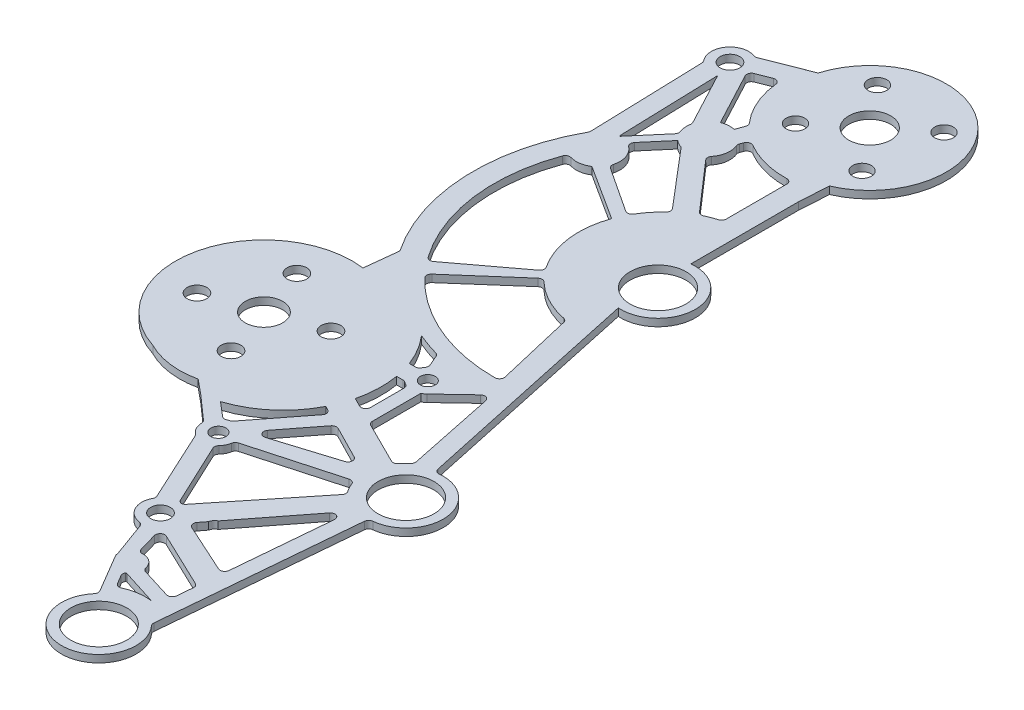
from build123d import *
from build123d.topology import SkipClean

# Parameters (mm, degrees)
SKETCH1_R            = 1.6
SKETCH1_R_2          = 2
SKETCH1_R_3          = 1.65
SKETCH1_R_4          = 6
BOSS_EXTRUDE2_DEPTH  = 1.5875
BOSS_EXTRUDE3_START  = -1.5875
BOSS_EXTRUDE3_DEPTH  = 1.5875
SKETCH4_R            = 4.4
SKETCH4_R_2          = 2.1
CUT_EXTRUDE1_DEPTH   = 1.5875
BOSS_EXTRUDE4_START  = -1.5875
BOSS_EXTRUDE4_DEPTH  = 1.5875
SKETCH7_R            = 2.1
CUT_EXTRUDE2_DEPTH   = 1.5875
CUT_EXTRUDE3_DEPTH   = 1.5875
CUT_EXTRUDE4_DEPTH   = 1.5875
SKETCH10_R           = 4.645349595
BOSS_EXTRUDE5_DEPTH  = 1.5875
CUT_EXTRUDE5_DEPTH   = 1.5875
CUT_EXTRUDE9_DEPTH   = 1.5875
SKETCH19_R           = 4
BOSS_EXTRUDE8_DEPTH  = 1.5875
SKETCH20_R           = 2.1
CUT_EXTRUDE12_DEPTH  = 1.5875
FILLET1_START        = -1
FILLET1_DEPTH        = 4
FILLET1_2_DEPTH      = 1.5875
SKETCH21_R           = 21
BOSS_EXTRUDE9_DEPTH  = 1.5875
SKETCH22_R           = 19
SKETCH22_R_2         = 16.40193841
CUT_EXTRUDE13_DEPTH  = 1.5875
FILLET2_R            = 5
SKETCH23_R           = 8
BOSS_EXTRUDE10_DEPTH = 1.5875
SKETCH24_R           = 6
CUT_EXTRUDE14_DEPTH  = 1.5875
BOSS_EXTRUDE12_DEPTH = 1.5875
CUT_EXTRUDE15_DEPTH  = 10
BOSS_EXTRUDE13_DEPTH = 1.5875
SKETCH30_R           = 16.40193841
BOSS_EXTRUDE14_DEPTH = 1.5875
SKETCH31_R           = 4
SKETCH31_R_2         = 2.1
CUT_EXTRUDE16_DEPTH  = 1.5875
SKETCH33_R           = 18.948767504
SKETCH33_R_2         = 2.1
SKETCH33_R_3         = 4
BOSS_EXTRUDE15_DEPTH = 1.5875
SKETCH34_R           = 4.5
SKETCH34_R_2         = 2
CUT_EXTRUDE18_DEPTH  = 10


with BuildPart() as part:
    # Sketch1 → Boss-Extrude2 (new body)
    with BuildSketch(Plane(origin=(0, 0, 0), x_dir=(1, 0, 0), z_dir=(0, 1, 0))):
        with BuildLine():
            Line((57.785577921, -3.804263015), (46.607089569, 48.169037391))
            ThreePointArc((46.607089569, 48.169037391), (54.607089569, 56.169037391), (46.607089569, 64.169037391))
            Line((46.607089569, 64.169037391), (46.607089569, 96.669037391))
            ThreePointArc((46.607089569, 96.669037391), (9.774896481, 73.010639225), (15.974342375, 29.675928865))
            Line((15.974342375, 29.675928865), (13.412399058, 22.705365919))
            ThreePointArc((13.412399058, 22.705365919), (-1.253243965, 6.307648563), (13.412399058, -10.090068793))
            Line((13.412399058, -10.090068793), (44.33382846, -62.316035804))
            ThreePointArc((44.33382846, -62.316035804), (50, -75.963557391), (55.66617154, -62.316035804))
            Line((55.66617154, -62.316035804), (59.462816555, -19.578912916))
            ThreePointArc((59.462816555, -19.578912916), (67.394599283, -10.759075533), (57.785577921, -3.804263015))
        make_face()
        with Locations(Location((27.233234802, -19.578912916, 0), (0, 0, 270))):
            Circle(SKETCH1_R, mode=Mode.SUBTRACT)
        with Locations(Location((44.33382846, -37.488387538, 0), (0, 0, 270))):
            Circle(SKETCH1_R, mode=Mode.SUBTRACT)
        with Locations(Location((40.089632361, 12.439739227, 0), (0, 0, 270))):
            Circle(SKETCH1_R, mode=Mode.SUBTRACT)
        with Locations(Location((12.005418324, 17.147101033, 0), (0, 0, 270))):
            Circle(SKETCH1_R_2, mode=Mode.SUBTRACT)
        with Locations(Location((26.086208505, 9.548986275, 0), (0, 0, 270))):
            Circle(SKETCH1_R_3, mode=Mode.SUBTRACT)
        with Locations(Location((4.407303566, 3.066310852, 0), (0, 0, 270))):
            Circle(SKETCH1_R_2, mode=Mode.SUBTRACT)
        with Locations(Location((18.488093747, -4.531803906, 0), (0, 0, 270))):
            Circle(SKETCH1_R_3, mode=Mode.SUBTRACT)
        with Locations(Location((46.607089569, 56.169037391, 0), (0, 0, 270))):
            Circle(SKETCH1_R_4, mode=Mode.SUBTRACT)
        with Locations(Location((59.462816555, -11.60242182, 0), (0, 0, 270))):
            Circle(SKETCH1_R_4, mode=Mode.SUBTRACT)
        with Locations(Location((50, -67.963557391, 0), (0, 0, 270))):
            Circle(SKETCH1_R_4, mode=Mode.SUBTRACT)
    extrude(amount=BOSS_EXTRUDE2_DEPTH)

    # Sketch3 → Boss-Extrude3 (add)
    with BuildSketch(Plane(origin=(0, 1.5875, 0), x_dir=(1, 0, 0), z_dir=(0, 1, 0)).offset(BOSS_EXTRUDE3_START)):
        with BuildLine():
            ThreePointArc((56.343437375, 106.672616503), (38.029280092, 122.267991205), (25.551142047, 101.702968958))
            ThreePointArc((25.551142047, 101.702968958), (27.87263843, 97.242332074), (31.478334129, 93.737252132))
            ThreePointArc((31.478334129, 93.737252132), (38.901984022, 95.929336038), (46.607089569, 96.669037391))
            Line((46.607089569, 96.669037391), (46.607089569, 92.08436081))
            ThreePointArc((46.607089569, 92.08436081), (53.685796044, 97.903157102), (56.343437375, 106.672616503))
        make_face()
        with BuildLine():
            ThreePointArc((46.607089569, 96.669037391), (38.901984022, 95.929336038), (31.478334129, 93.737252132))
            ThreePointArc((31.478334129, 93.737252132), (38.83054718, 90.968883646), (46.607089569, 92.08436081))
            Line((46.607089569, 92.08436081), (46.607089569, 96.669037391))
        make_face()
        with BuildLine():
            Line((25.551142047, 101.702968958), (23.684957519, 89.558045497))
            ThreePointArc((23.684957519, 89.558045497), (27.467237121, 91.860997946), (31.478334129, 93.737252132))
            ThreePointArc((31.478334129, 93.737252132), (27.87263843, 97.242332074), (25.551142047, 101.702968958))
        make_face()
        with BuildLine():
            Line((14.718034312, 31.202296417), (13.412399058, 22.705365919))
            Line((13.412399058, 22.705365919), (15.974342375, 29.675928865))
            ThreePointArc((15.974342375, 29.675928865), (15.33687379, 30.431446107), (14.718034312, 31.202296417))
        make_face()
    extrude(amount=BOSS_EXTRUDE3_DEPTH)

    # Sketch4 → Cut-Extrude1 (cut)
    with BuildSketch(Plane(origin=(0, 1.5875, 0), x_dir=(1, 0, 0), z_dir=(0, 1, 0))):
        with Locations(Location((40.546257627, 106.672616503, 0), (0, 0, 270))):
            Circle(SKETCH4_R)
        with Locations(Location((40.546257627, 117.14024961, 0), (0, 0, 270))):
            Circle(SKETCH4_R_2)
        with Locations(Location((30.07862452, 106.672616503, 0), (0, 0, 270))):
            Circle(SKETCH4_R_2)
        with Locations(Location((51.013890734, 106.672616503, 0), (0, 0, 270))):
            Circle(SKETCH4_R_2)
        with Locations(Location((40.546257627, 96.204983396, 0), (0, 0, 270))):
            Circle(SKETCH4_R_2)
    extrude(amount=-CUT_EXTRUDE1_DEPTH, mode=Mode.SUBTRACT)

    # Sketch5 → Boss-Extrude4 (add)
    with BuildSketch(Plane(origin=(0, 1.5875, 0), x_dir=(1, 0, 0), z_dir=(0, 1, 0)).offset(BOSS_EXTRUDE4_START)):
        with BuildLine():
            ThreePointArc((25.551142047, 101.702968958), (24.749079693, 106.66504565), (25.546385494, 111.627888844))
            Line((25.546385494, 111.627888844), (15.069905078, 107.519355049))
            ThreePointArc((15.069905078, 107.519355049), (16.746586116, 106.043341376), (17.370320575, 103.898386599))
            ThreePointArc((17.370320575, 103.898386599), (14.869777486, 100.190067711), (10.494506089, 101.118154407))
            Line((10.494506089, 101.118154407), (11.270868269, 75.957960157))
            ThreePointArc((11.270868269, 75.957960157), (16.694725669, 83.472892173), (23.684957519, 89.558045497))
            Line((23.684957519, 89.558045497), (25.551142047, 101.702968958))
        make_face()
        with BuildLine():
            ThreePointArc((17.370320575, 103.898386599), (16.746586116, 106.043341376), (15.069905078, 107.519355049))
            Line((15.069905078, 107.519355049), (10.494506089, 101.118154407))
            ThreePointArc((10.494506089, 101.118154407), (14.869777486, 100.190067711), (17.370320575, 103.898386599))
        make_face()
        with BuildLine():
            Line((10.494506089, 101.118154407), (15.069905078, 107.519355049))
            ThreePointArc((15.069905078, 107.519355049), (10.116135322, 106.224387102), (10.494506089, 101.118154407))
        make_face()
    extrude(amount=BOSS_EXTRUDE4_DEPTH)

    # Sketch7 → Cut-Extrude2 (cut)
    with BuildSketch(Plane(origin=(0, 1.5875, 0), x_dir=(1, 0, 0), z_dir=(0, 1, 0))):
        with Locations(Location((13.370320575, 103.898386599, 0), (0, 0, 270))):
            Circle(SKETCH7_R)
    extrude(amount=-CUT_EXTRUDE2_DEPTH, mode=Mode.SUBTRACT)

    # Sketch8 → Cut-Extrude3 (cut)
    with BuildSketch(Plane(origin=(0, 1.5875, 0), x_dir=(1, 0, 0), z_dir=(0, 1, 0))):
        with BuildLine():
            Line((22.270838211, 106.046731613), (17.002624642, 103.98071014))
            Line((17.002624642, 103.98071014), (25.133766385, 88.688000928))
            Line((25.133766385, 88.688000928), (27.134869461, 94.242115541))
            ThreePointArc((27.134869461, 94.242115541), (23.639138303, 99.70612507), (22.270838211, 106.046731613))
        make_face()
        with BuildLine():
            Line((23.303910604, 83.609187721), (14.527339538, 100.115793242))
            Line((14.527339538, 100.115793242), (15.199341327, 78.337690198))
            ThreePointArc((15.199341327, 78.337690198), (19.20721627, 76.294929401), (19.633932022, 71.816777227))
            Line((19.633932022, 71.816777227), (30.72905948, 64.509035556))
            ThreePointArc((30.72905948, 64.509035556), (32.607236437, 67.379368393), (34.997517814, 69.839635497))
            Line((34.997517814, 69.839635497), (23.303910604, 83.609187721))
        make_face()
        with BuildLine():
            ThreePointArc((19.292849703, 71.170332955), (16.555809564, 69.154810129), (13.177202224, 69.527279496))
            ThreePointArc((13.177202224, 69.527279496), (10.918653361, 51.442990309), (17.806438222, 34.569905881))
            Line((17.806438222, 34.569905881), (32.25869406, 45.408416813))
            ThreePointArc((32.25869406, 45.408416813), (28.762210797, 54.372454379), (30.401676947, 63.853567998))
            Line((30.401676947, 63.853567998), (19.292849703, 71.170332955))
        make_face()
    extrude(amount=-CUT_EXTRUDE3_DEPTH, mode=Mode.SUBTRACT)

    # Sketch9 → Cut-Extrude4 (cut)
    with BuildSketch(Plane(origin=(0, 1.5875, 0), x_dir=(1, 0, 0), z_dir=(0, 1, 0))):
        with BuildLine():
            ThreePointArc((42.074546437, 88.450459111), (35.884397618, 88.990711969), (30.232534907, 91.572622783))
            Line((30.232534907, 91.572622783), (29.429468095, 89.400967731))
            ThreePointArc((29.429468095, 89.400967731), (29.783097277, 88.406341356), (29.90303822, 87.357556633))
            ThreePointArc((29.90303822, 87.357556633), (29.485817932, 85.43344764), (28.309102029, 83.854964865))
            Line((28.309102029, 83.854964865), (38.418011185, 72.251364401))
            ThreePointArc((38.418011185, 72.251364401), (40.208614988, 73.043923164), (42.074546437, 73.637818103))
            Line((42.074546437, 73.637818103), (42.074546437, 88.450459111))
        make_face()
    extrude(amount=-CUT_EXTRUDE4_DEPTH, mode=Mode.SUBTRACT)

    # Sketch10 → Boss-Extrude5 (add)
    with BuildSketch(Plane(origin=(0, 1.5875, 0), x_dir=(1, 0, 0), z_dir=(0, 1, 0))):
        with BuildLine():
            Line((21.149022647, 85.190038065), (15.318075384, 78.339844161))
            Line((15.318075384, 78.339844161), (17.303228542, 77.909062399))
            Line((17.303228542, 77.909062399), (22.298101959, 83.77703717))
            ThreePointArc((22.298101959, 83.77703717), (21.653636497, 84.426672617), (21.149022647, 85.190038065))
        make_face()
        with Locations((25.257688625, 87.357556633)):
            Circle(SKETCH10_R)
    extrude(amount=-BOSS_EXTRUDE5_DEPTH)

    # Sketch11 → Cut-Extrude5 (cut)
    with BuildSketch(Plane(origin=(0, 1.5875, 0), x_dir=(1, 0, 0), z_dir=(0, 1, 0))):
        with BuildLine():
            ThreePointArc((43.678327763, 38.474694703), (38.177130614, 40.338585695), (33.560088051, 43.862812939))
            Line((33.560088051, 43.862812939), (19.964301754, 31.958257613))
            ThreePointArc((19.964301754, 31.958257613), (32.669274368, 22.976608926), (47.977761412, 20.195140484))
            Line((47.977761412, 20.195140484), (43.678327763, 38.474694703))
        make_face()
        with BuildLine():
            ThreePointArc((36.26030403, 18.303590576), (27.299157807, 21.99226451), (19.51475195, 27.763874553))
            Line((19.51475195, 27.763874553), (18.938710266, 22.389298788))
            ThreePointArc((18.938710266, 22.389298788), (25.46420767, 19.263484394), (30.024920763, 13.646302887))
            Line((30.024920763, 13.646302887), (36.804178947, 13.646302887))
            ThreePointArc((36.804178947, 13.646302887), (37.166998848, 14.365411409), (37.684600309, 14.982537063))
            Line((37.684600309, 14.982537063), (36.26030403, 18.303590576))
        make_face()
        with BuildLine():
            Line((23.748837452, -19.248799138), (13.412399058, -10.090068793))
            Line((13.412399058, -10.090068793), (32.107751545, -41.666321285))
            ThreePointArc((32.107751545, -41.666321285), (32.068874877, -40.005058031), (32.708438415, -38.471348322))
            Line((32.708438415, -38.471348322), (25.310969778, -22.503788499))
            ThreePointArc((25.310969778, -22.503788499), (24.077804809, -21.093264776), (23.748837452, -19.248799138))
        make_face()
        with BuildLine():
            Line((37.684600309, 9.896941391), (31.351630359, 9.896941391))
            ThreePointArc((31.351630359, 9.896941391), (31.742887661, 6.664917922), (31.491928413, 3.418985476))
            Line((31.491928413, 3.418985476), (38.929266279, -0.294255815))
            Line((38.929266279, -0.294255815), (38.929266279, 9.137686751))
            ThreePointArc((38.929266279, 9.137686751), (38.266960458, 9.451785557), (37.684600309, 9.896941391))
        make_face()
        with BuildLine():
            ThreePointArc((29.936377952, -1.206671629), (24.790621379, -7.152092679), (17.477492698, -10.040862499))
            Line((17.477492698, -10.040862499), (25.310969778, -16.654037333))
            ThreePointArc((25.310969778, -16.654037333), (25.917615868, -16.335589494), (26.574677388, -16.14142806))
            Line((26.574677388, -16.14142806), (35.856851812, -4.235227198))
            Line((35.856851812, -4.235227198), (29.936377952, -1.206671629))
        make_face()
        with BuildLine():
            ThreePointArc((36, -44.74414887), (34.564180779, -44.477568638), (33.319742068, -43.713360451))
            Line((33.319742068, -43.713360451), (38.988258823, -53.287425259))
            ThreePointArc((38.988258823, -53.287425259), (38.982277864, -53.110729221), (38.987264085, -52.934002315))
            Line((38.987264085, -52.934002315), (36, -44.74414887))
        make_face()
        with BuildLine():
            Line((49.652635334, 16.6671019), (42.494664412, 9.896941391))
            ThreePointArc((42.494664412, 9.896941391), (42.113801435, 9.58443897), (41.69283275, 9.328509806))
            Line((41.69283275, 9.328509806), (41.69283275, -1.674022247))
            Line((41.69283275, -1.674022247), (51.893737087, -6.76702997))
            ThreePointArc((51.893737087, -6.76702997), (52.859204313, -5.514377495), (54.029419034, -4.450487136))
            Line((54.029419034, -4.450487136), (49.652635334, 16.6671019))
        make_face()
        with BuildLine():
            ThreePointArc((30.733234802, -19.578912916), (30.347372441, -21.176456895), (29.274865223, -22.421753964))
            Line((29.274865223, -22.421753964), (36, -36.74414887))
            ThreePointArc((36, -36.74414887), (36.404157783, -36.764619188), (36.804178947, -36.825820626))
            Line((36.804178947, -36.825820626), (52.50945718, -17.287733752))
            ThreePointArc((52.50945718, -17.287733752), (51.488220715, -15.734951255), (50.808425135, -14.005230072))
            Line((50.808425135, -14.005230072), (30.733234802, -19.578912916))
        make_face()
        with BuildLine():
            Line((53.46362734, -50.406848658), (38.929266279, -43.468006257))
            Line((38.929266279, -43.468006257), (40.907560182, -50.406848658))
            ThreePointArc((40.907560182, -50.406848658), (43.470698918, -50.770628666), (44.682047755, -53.058564433))
            Line((44.682047755, -53.058564433), (52.998564734, -55.641373157))
            Line((52.998564734, -55.641373157), (53.46362734, -50.406848658))
        make_face()
        Polygon((48.53670869, -10.721473414), (38.603269126, -5.640127828), (30.179720323, -16.453526736), align=None)
        with BuildLine():
            ThreePointArc((43.380170812, -55.495829677), (43.141144188, -55.634475907), (42.889814418, -55.749322982))
            Line((42.889814418, -55.749322982), (44.97511935, -59.271380942))
            ThreePointArc((44.97511935, -59.271380942), (48.033331446, -58.11797098), (51.299968657, -58.007984155))
            Line((51.299968657, -58.007984155), (43.380170812, -55.495829677))
        make_face()
        Polygon((53.899807967, -45.497406051), (56.16883109, -19.958356125), (40.907560182, -39.577437576), align=None)
    extrude(amount=-CUT_EXTRUDE5_DEPTH, mode=Mode.SUBTRACT)

    # Sketch13 → Cut-Extrude9 (cut)
    with BuildSketch(Plane(origin=(0, 1.5875, 0), x_dir=(1, 0, 0), z_dir=(0, 1, 0))):
        with BuildLine():
            ThreePointArc((32.281400747, -39.270371546), (32.010464376, -40.455002704), (32.107751545, -41.666321285))
            Line((32.107751545, -41.666321285), (33.319742068, -43.713360451))
            ThreePointArc((33.319742068, -43.713360451), (33.86679158, -44.127848301), (34.476645862, -44.442715101))
            Line((34.476645862, -44.442715101), (32.281400747, -39.270371546))
        make_face()
    extrude(amount=-CUT_EXTRUDE9_DEPTH, mode=Mode.SUBTRACT)

    # Sketch19 → Boss-Extrude8 (add)
    with BuildSketch(Plane(origin=(0, 1.5875, 0), x_dir=(1, 0, 0), z_dir=(0, 1, 0))):
        with Locations((36, -40.74414887)):
            Circle(SKETCH19_R)
    extrude(amount=-BOSS_EXTRUDE8_DEPTH)

    # Sketch20 → Cut-Extrude12 (cut)
    with BuildSketch(Plane(origin=(0, 1.5875, 0), x_dir=(1, 0, 0), z_dir=(0, 1, 0))):
        with Locations(Location((36, -40.74414887, 0), (0, 0, 270))):
            Circle(SKETCH20_R)
    extrude(amount=-CUT_EXTRUDE12_DEPTH, mode=Mode.SUBTRACT)

    # Fillet1: read off the stored shape, not the designer's step
    # Fillet1 outline → Fillet1 (cut)
    with BuildSketch(Plane(origin=(0, 0, 0), x_dir=(1, 0, 0), z_dir=(0, 1, 0)).offset(FILLET1_START)):
        with BuildLine():
            Line((38.988258823, -53.287425259), (39.124224156, -53.517069268))
            ThreePointArc((39.124224156, -53.517069268), (39.013748973, -53.246825905), (38.9860351, -52.9561918))
            ThreePointArc((38.9860351, -52.9561918), (38.9823308, -53.121840863), (38.988258823, -53.287425259))
        make_face()
    extrude(amount=FILLET1_DEPTH, mode=Mode.SUBTRACT)

    # Fillet1 2 outline → Fillet1 2 (add)
    with BuildSketch(Plane(origin=(0, 0, 0), x_dir=(1, 0, 0), z_dir=(0, 1, 0))):
        with BuildLine():
            ThreePointArc((15.444488116, 107.666254295), (15.091836344, 107.5973016), (14.7375778, 107.657456654))
            ThreePointArc((14.7375778, 107.657456654), (14.90529535, 107.592145178), (15.069905078, 107.519355049))
            Line((15.069905078, 107.519355049), (15.444488116, 107.666254295))
        make_face()
        with BuildLine():
            ThreePointArc((10.494506089, 101.118154407), (10.384296967, 101.236871426), (10.278984883, 101.359953294))
            ThreePointArc((10.278984883, 101.359953294), (10.44233834, 101.076846306), (10.50567523, 100.756187053))
            Line((10.50567523, 100.756187053), (10.494506089, 101.118154407))
        make_face()
        with BuildLine():
            ThreePointArc((25.692555244, 112.050200859), (25.468650898, 111.69289574), (25.117375671, 111.459645189))
            Line((25.117375671, 111.459645189), (25.546385494, 111.627888844))
            ThreePointArc((25.546385494, 111.627888844), (25.617976926, 111.839561759), (25.692555244, 112.050200859))
        make_face()
        with BuildLine():
            Line((11.270868269, 75.957960157), (11.262366221, 76.233492858))
            ThreePointArc((11.262366221, 76.233492858), (11.235014007, 75.968382776), (11.138606955, 75.719913101))
            ThreePointArc((11.138606955, 75.719913101), (11.204537532, 75.839047795), (11.270868269, 75.957960157))
        make_face()
        with BuildLine():
            ThreePointArc((46.607089569, 91.431556836), (46.764368327, 91.969907009), (47.186731387, 92.338915089))
            ThreePointArc((47.186731387, 92.338915089), (46.898185768, 92.208734006), (46.607089569, 92.08436081))
            Line((46.607089569, 92.08436081), (46.607089569, 91.431556836))
        make_face()
        with BuildLine():
            ThreePointArc((47.495978458, 64.119501311), (46.861733576, 64.446642634), (46.607089569, 65.113309301))
            Line((46.607089569, 65.113309301), (46.607089569, 64.169037391))
            ThreePointArc((46.607089569, 64.169037391), (47.052223616, 64.156643771), (47.495978458, 64.119501311))
        make_face()
        with BuildLine():
            Line((13.412399058, 22.705365919), (13.526020591, 23.444802343))
            ThreePointArc((13.526020591, 23.444802343), (13.245775736, 22.89062196), (12.692428908, 22.608734813))
            ThreePointArc((12.692428908, 22.608734813), (13.051882136, 22.661013005), (13.412399058, 22.705365919))
        make_face()
        with BuildLine():
            ThreePointArc((46.849527021, 47.041847905), (47.008370288, 47.826200241), (47.691605317, 48.242889172))
            ThreePointArc((47.691605317, 48.242889172), (47.150603252, 48.187521691), (46.607089569, 48.169037391))
            Line((46.607089569, 48.169037391), (46.849527021, 47.041847905))
        make_face()
        with BuildLine():
            ThreePointArc((13.412399058, -10.090068793), (13.262072415, -10.072553845), (13.111912747, -10.053660802))
            ThreePointArc((13.111912747, -10.053660802), (13.397038675, -10.13521072), (13.645709583, -10.296796497))
            Line((13.645709583, -10.296796497), (13.412399058, -10.090068793))
        make_face()
        with BuildLine():
            ThreePointArc((58.664749342, -3.66595542), (57.976068497, -3.479376972), (57.587054161, -2.881245992))
            Line((57.587054161, -2.881245992), (57.785577921, -3.804263015))
            ThreePointArc((57.785577921, -3.804263015), (58.223233155, -3.722837873), (58.664749342, -3.66595542))
        make_face()
        with BuildLine():
            Line((23.748837452, -19.248799138), (23.397693357, -18.937663527))
            ThreePointArc((23.397693357, -18.937663527), (23.64147446, -19.264910706), (23.73422824, -19.662298022))
            ThreePointArc((23.73422824, -19.662298022), (23.735417214, -19.45533251), (23.748837452, -19.248799138))
        make_face()
        with BuildLine():
            ThreePointArc((59.386033328, -20.443227125), (59.670076057, -19.829571274), (60.279699229, -19.53697366))
            ThreePointArc((60.279699229, -19.53697366), (59.871795835, -19.568421202), (59.462816555, -19.578912916))
            Line((59.462816555, -19.578912916), (59.386033328, -20.443227125))
        make_face()
        with BuildLine():
            ThreePointArc((25.310969778, -22.503788499), (25.214039112, -22.437732386), (25.119376368, -22.368465303))
            ThreePointArc((25.119376368, -22.368465303), (25.294189119, -22.538173568), (25.42277364, -22.745119005))
            Line((25.42277364, -22.745119005), (25.310969778, -22.503788499))
        make_face()
        with BuildLine():
            ThreePointArc((55.957364504, -62.624099726), (55.753138458, -62.272254629), (55.705957884, -61.86817884))
            Line((55.705957884, -61.86817884), (55.66617154, -62.316035804))
            ThreePointArc((55.66617154, -62.316035804), (55.813808854, -62.468138698), (55.957364504, -62.624099726))
        make_face()
        with BuildLine():
            Line((32.708438415, -38.471348322), (32.485434781, -37.989991246))
            ThreePointArc((32.485434781, -37.989991246), (32.577742837, -38.436239317), (32.462462365, -38.877111783))
            ThreePointArc((32.462462365, -38.877111783), (32.579428405, -38.670579492), (32.708438415, -38.471348322))
        make_face()
        with BuildLine():
            ThreePointArc((43.957094166, -61.679735568), (44.093326483, -62.27012019), (43.863649318, -62.830799818))
            ThreePointArc((43.863649318, -62.830799818), (44.09312873, -62.568293561), (44.33382846, -62.316035804))
            Line((44.33382846, -62.316035804), (43.957094166, -61.679735568))
        make_face()
        with BuildLine():
            ThreePointArc((36, -44.74414887), (35.711799539, -44.733752922), (35.425097136, -44.702619117))
            ThreePointArc((35.425097136, -44.702619117), (35.912209485, -44.916322163), (36.220827824, -45.34956823))
            Line((36.220827824, -45.34956823), (36, -44.74414887))
        make_face()
        with BuildLine():
            ThreePointArc((43.396527569, -55.58304418), (43.595224077, -55.584755398), (43.789659652, -55.625719258))
            Line((43.789659652, -55.625719258), (43.380170812, -55.495829677))
            ThreePointArc((43.380170812, -55.495829677), (43.141144188, -55.634475907), (42.889814418, -55.749322982))
            Line((42.889814418, -55.749322982), (43.395587309, -56.603568042))
            ThreePointArc((43.395587309, -56.603568042), (43.256076417, -56.093177139), (43.396527569, -55.58304418))
        make_face()
        with BuildLine():
            ThreePointArc((44.97511935, -59.271380942), (45.370345823, -59.05459229), (45.77490484, -58.855762495))
            ThreePointArc((45.77490484, -58.855762495), (45.057666006, -58.903678352), (44.493593613, -58.458089068))
            Line((44.493593613, -58.458089068), (44.97511935, -59.271380942))
        make_face()
        with BuildLine():
            ThreePointArc((39.536976189, -45.599541558), (39.853245067, -44.561526362), (40.929485064, -44.422929756))
            Line((40.929485064, -44.422929756), (38.929266279, -43.468006257))
            Line((38.929266279, -43.468006257), (39.536976189, -45.599541558))
        make_face()
        with BuildLine():
            Line((53.46362734, -50.406848658), (52.836923599, -50.107654323))
            ThreePointArc((52.836923599, -50.107654323), (53.274713658, -50.514608843), (53.402169943, -51.098584024))
            Line((53.402169943, -51.098584024), (53.46362734, -50.406848658))
        make_face()
        with BuildLine():
            ThreePointArc((41.675157171, -50.256983006), (41.039836018, -50.07299683), (40.658331922, -49.532683491))
            Line((40.658331922, -49.532683491), (40.907560182, -50.406848658))
            ThreePointArc((40.907560182, -50.406848658), (41.286193643, -50.305461041), (41.675157171, -50.256983006))
        make_face()
        with BuildLine():
            Line((52.998564734, -55.641373157), (53.10819241, -54.407455939))
            ThreePointArc((53.10819241, -54.407455939), (52.668918872, -55.149603906), (51.81552602, -55.273964215))
            Line((51.81552602, -55.273964215), (52.998564734, -55.641373157))
        make_face()
        with BuildLine():
            ThreePointArc((45.300238966, -53.250552215), (44.85866114, -52.970164496), (44.619052098, -52.505195942))
            ThreePointArc((44.619052098, -52.505195942), (44.664099354, -52.780337716), (44.682047755, -53.058564433))
            Line((44.682047755, -53.058564433), (45.300238966, -53.250552215))
        make_face()
        with BuildLine():
            ThreePointArc((54.082769495, -22.640086408), (55.238224697, -22.323517676), (55.868159476, -23.342573445))
            Line((55.868159476, -23.342573445), (56.16883109, -19.958356125))
            Line((56.16883109, -19.958356125), (54.082769495, -22.640086408))
        make_face()
        with BuildLine():
            Line((40.907560182, -39.577437576), (42.059430997, -40.102292014))
            ThreePointArc((42.059430997, -40.102292014), (41.502987168, -39.431049836), (41.684756218, -38.578315522))
            Line((41.684756218, -38.578315522), (40.907560182, -39.577437576))
        make_face()
        with BuildLine():
            Line((53.899807967, -45.497406051), (54.024841251, -44.090090606))
            ThreePointArc((54.024841251, -44.090090606), (53.531983114, -44.865753254), (52.614126049, -44.911580061))
            Line((52.614126049, -44.911580061), (53.899807967, -45.497406051))
        make_face()
        with BuildLine():
            ThreePointArc((30.680385801, -20.184841946), (30.92479003, -19.685903822), (31.397765159, -19.394412476))
            Line((31.397765159, -19.394412476), (30.733234802, -19.578912916))
            ThreePointArc((30.733234802, -19.578912916), (30.71999752, -19.883027617), (30.680385801, -20.184841946))
        make_face()
        with BuildLine():
            Line((50.808425135, -14.005230072), (49.89326045, -14.259316714))
            ThreePointArc((49.89326045, -14.259316714), (50.608670804, -14.328779808), (51.092684865, -14.860162424))
            ThreePointArc((51.092684865, -14.860162424), (50.939828575, -14.436262718), (50.808425135, -14.005230072))
        make_face()
        with BuildLine():
            ThreePointArc((29.593458015, -23.100255131), (29.511396297, -22.515990701), (29.772992179, -21.987155525))
            ThreePointArc((29.772992179, -21.987155525), (29.53421231, -22.216241585), (29.274865223, -22.421753964))
            Line((29.274865223, -22.421753964), (29.593458015, -23.100255131))
        make_face()
        with BuildLine():
            ThreePointArc((52.50945718, -17.287733752), (52.282209789, -16.997870349), (52.067037678, -16.698933682))
            ThreePointArc((52.067037678, -16.698933682), (52.242936776, -17.303199982), (52.023026445, -17.892875911))
            Line((52.023026445, -17.892875911), (52.50945718, -17.287733752))
        make_face()
        with BuildLine():
            ThreePointArc((36.414776344, -36.757901365), (36.020903156, -36.560173528), (35.750281599, -36.212328218))
            Line((35.750281599, -36.212328218), (36, -36.74414887))
            ThreePointArc((36, -36.74414887), (36.404157783, -36.764619188), (36.804178947, -36.825820626))
            Line((36.804178947, -36.825820626), (37.158481456, -36.385052045))
            ThreePointArc((37.158481456, -36.385052045), (36.827242346, -36.652486448), (36.414776344, -36.757901365))
        make_face()
        with BuildLine():
            ThreePointArc((46.356924582, -9.606427987), (46.897893471, -10.581693068), (46.199572782, -11.451254758))
            Line((46.199572782, -11.451254758), (48.53670869, -10.721473414))
            Line((48.53670869, -10.721473414), (46.356924582, -9.606427987))
        make_face()
        with BuildLine():
            Line((30.179720323, -16.453526736), (33.231234935, -15.500677384))
            ThreePointArc((33.231234935, -15.500677384), (32.111143203, -15.115574645), (32.144285517, -13.931593567))
            Line((32.144285517, -13.931593567), (30.179720323, -16.453526736))
        make_face()
        with BuildLine():
            ThreePointArc((38.095121492, -6.292442333), (38.667653502, -5.930664926), (39.339422709, -6.01669938))
            Line((39.339422709, -6.01669938), (38.603269126, -5.640127828))
            Line((38.603269126, -5.640127828), (38.095121492, -6.292442333))
        make_face()
        with BuildLine():
            ThreePointArc((26.789581852, -15.86577113), (26.559782265, -16.080198457), (26.27477536, -16.212705035))
            ThreePointArc((26.27477536, -16.212705035), (26.423941295, -16.173763283), (26.574677388, -16.14142806))
            Line((26.574677388, -16.14142806), (26.789581852, -15.86577113))
        make_face()
        with BuildLine():
            ThreePointArc((25.310969778, -16.654037333), (25.567850855, -16.500521078), (25.836906925, -16.369509785))
            ThreePointArc((25.836906925, -16.369509785), (25.293089517, -16.441988659), (24.792875584, -16.216652063))
            Line((24.792875584, -16.216652063), (25.310969778, -16.654037333))
        make_face()
        with BuildLine():
            ThreePointArc((34.779755447, -3.684249984), (35.300698157, -4.358361524), (35.112994149, -5.189369875))
            Line((35.112994149, -5.189369875), (35.856851812, -4.235227198))
            Line((35.856851812, -4.235227198), (34.779755447, -3.684249984))
        make_face()
        with BuildLine():
            Line((17.477492698, -10.040862499), (19.061976017, -11.378514362))
            ThreePointArc((19.061976017, -11.378514362), (18.731532688, -10.394506096), (19.452182221, -9.64742557))
            ThreePointArc((19.452182221, -9.64742557), (18.470844466, -9.87429365), (17.477492698, -10.040862499))
        make_face()
        with BuildLine():
            ThreePointArc((29.482985561, -2.033800286), (30.065613971, -1.579393227), (30.801200695, -1.649062525))
            Line((30.801200695, -1.649062525), (29.936377952, -1.206671629))
            ThreePointArc((29.936377952, -1.206671629), (29.715593441, -1.62347646), (29.482985561, -2.033800286))
        make_face()
        with BuildLine():
            ThreePointArc((32.145558455, 3.092647463), (31.708684846, 3.519026725), (31.601078569, 4.119924981))
            ThreePointArc((31.601078569, 4.119924981), (31.550270876, 3.768868572), (31.491928413, 3.418985476))
            Line((31.491928413, 3.418985476), (32.145558455, 3.092647463))
        make_face()
        with BuildLine():
            ThreePointArc((31.351630359, 9.896941391), (31.468546625, 9.324850918), (31.565147256, 8.748981801))
            ThreePointArc((31.565147256, 8.748981801), (31.796526121, 9.549643624), (32.554140663, 9.896941391))
            Line((32.554140663, 9.896941391), (31.351630359, 9.896941391))
        make_face()
        with BuildLine():
            ThreePointArc((38.929266279, 1.322722212), (38.455245757, 0.472224953), (37.482575102, 0.428034003))
            Line((37.482575102, 0.428034003), (38.929266279, -0.294255815))
            Line((38.929266279, -0.294255815), (38.929266279, 1.322722212))
        make_face()
        with BuildLine():
            Line((37.68460031, 9.896941391), (37.315000224, 9.896941391))
            ThreePointArc((37.315000224, 9.896941391), (37.641122588, 9.842268956), (37.931585143, 9.684229799))
            ThreePointArc((37.931585143, 9.684229799), (37.805615142, 9.787708808), (37.68460031, 9.896941391))
        make_face()
        with BuildLine():
            ThreePointArc((38.409347631, 9.369455327), (38.789522448, 9.00209342), (38.929266279, 8.492231356))
            Line((38.929266279, 8.492231356), (38.929266279, 9.137686751))
            ThreePointArc((38.929266279, 9.137686751), (38.6645873, 9.242983595), (38.409347631, 9.369455327))
        make_face()
        with BuildLine():
            ThreePointArc((19.752126314, 22.180633117), (19.196319374, 22.583175638), (19.030873712, 23.249200839))
            Line((19.030873712, 23.249200839), (18.938710266, 22.389298788))
            ThreePointArc((18.938710266, 22.389298788), (19.346745989, 22.290141559), (19.752126314, 22.180633117))
        make_face()
        with BuildLine():
            Line((19.51475195, 27.763874553), (19.305143765, 25.808191301))
            ThreePointArc((19.305143765, 25.808191301), (19.932356152, 26.631806904), (20.952996027, 26.458508651))
            ThreePointArc((20.952996027, 26.458508651), (20.225798943, 27.102294567), (19.51475195, 27.763874553))
        make_face()
        with BuildLine():
            ThreePointArc((30.632361128, 13.646302887), (30.120743367, 13.78708972), (29.753183694, 14.169808354))
            ThreePointArc((29.753183694, 14.169808354), (29.891391651, 13.909269949), (30.024920763, 13.646302887))
            Line((30.024920763, 13.646302887), (30.632361128, 13.646302887))
        make_face()
        with BuildLine():
            ThreePointArc((36.26030403, 18.303590576), (36.032512757, 18.366572409), (35.805104812, 18.430924577))
            ThreePointArc((35.805104812, 18.430924577), (36.190970587, 18.219874871), (36.448966554, 17.863683271))
            Line((36.448966554, 17.863683271), (36.26030403, 18.303590576))
        make_face()
        with BuildLine():
            ThreePointArc((37.039287786, 14.155955407), (36.672563954, 13.783068423), (36.167760765, 13.646302887))
            Line((36.167760765, 13.646302887), (36.804178947, 13.646302887))
            ThreePointArc((36.804178947, 13.646302887), (36.911500762, 13.905849571), (37.039287786, 14.155955407))
        make_face()
        with BuildLine():
            Line((37.684600309, 14.982537063), (37.433873579, 15.567160432))
            ThreePointArc((37.433873579, 15.567160432), (37.507172094, 15.049510139), (37.309228607, 14.565616686))
            ThreePointArc((37.309228607, 14.565616686), (37.488547631, 14.781609896), (37.684600309, 14.982537063))
        make_face()
        with BuildLine():
            ThreePointArc((43.052713924, 38.589679534), (43.550414739, 38.327671191), (43.827970549, 37.838470573))
            Line((43.827970549, 37.838470573), (43.678327763, 38.474694703))
            ThreePointArc((43.678327763, 38.474694703), (43.365011041, 38.529413367), (43.052713924, 38.589679534))
        make_face()
        with BuildLine():
            Line((47.977761412, 20.195140484), (47.69480094, 21.398180629))
            ThreePointArc((47.69480094, 21.398180629), (47.506263599, 20.549600562), (46.724629322, 20.169229275))
            ThreePointArc((46.724629322, 20.169229275), (47.351308143, 20.176730731), (47.977761412, 20.195140484))
        make_face()
        with BuildLine():
            ThreePointArc((32.853590913, 43.244199636), (33.534588096, 43.491601808), (34.203913056, 43.214168759))
            ThreePointArc((34.203913056, 43.214168759), (33.877868255, 43.534389252), (33.560088051, 43.862812939))
            Line((33.560088051, 43.862812939), (32.853590913, 43.244199636))
        make_face()
        with BuildLine():
            ThreePointArc((19.964301754, 31.958257613), (20.319561518, 31.57298346), (20.68039208, 31.192921653))
            ThreePointArc((20.68039208, 31.192921653), (20.401478928, 31.929138491), (20.741815227, 32.639053262))
            Line((20.741815227, 32.639053262), (19.964301754, 31.958257613))
        make_face()
        with BuildLine():
            ThreePointArc((12.809685216, 68.568047795), (13.298218258, 69.116516358), (14.02967141, 69.18328899))
            ThreePointArc((14.02967141, 69.18328899), (13.594956879, 69.334269459), (13.177202224, 69.527279496))
            ThreePointArc((13.177202224, 69.527279496), (12.990022198, 69.048974557), (12.809685216, 68.568047795))
        make_face()
        with BuildLine():
            ThreePointArc((19.292849703, 71.170332955), (19.052045796, 70.824962414), (18.781130711, 70.502670079))
            ThreePointArc((18.781130711, 70.502670079), (19.395002581, 70.817929007), (20.066899823, 70.66050931))
            Line((20.066899823, 70.66050931), (19.292849703, 71.170332955))
        make_face()
        with BuildLine():
            ThreePointArc((18.617887478, 35.17845459), (17.862331313, 34.990649433), (17.201077947, 35.401599406))
            ThreePointArc((17.201077947, 35.401599406), (17.500787296, 34.983590311), (17.806438222, 34.569905881))
            Line((17.806438222, 34.569905881), (18.617887478, 35.17845459))
        make_face()
        with BuildLine():
            Line((30.401676947, 63.853567998), (29.692663391, 64.320555685))
            ThreePointArc((29.692663391, 64.320555685), (30.099172004, 63.776955461), (30.064944293, 63.099032958))
            ThreePointArc((30.064944293, 63.099032958), (30.228964894, 63.478239881), (30.401676947, 63.853567998))
        make_face()
        with BuildLine():
            ThreePointArc((31.710427697, 46.181201091), (31.865703452, 45.456761587), (31.479815998, 44.824294965))
            Line((31.479815998, 44.824294965), (32.25869406, 45.408416813))
            ThreePointArc((32.25869406, 45.408416813), (31.979456671, 45.791187676), (31.710427697, 46.181201091))
        make_face()
        with BuildLine():
            ThreePointArc((20.279904522, 71.391311168), (19.896109183, 71.868772215), (19.862757263, 72.480454782))
            ThreePointArc((19.862757263, 72.480454782), (19.760826355, 72.144312513), (19.633932022, 71.816777227))
            Line((19.633932022, 71.816777227), (20.279904522, 71.391311168))
        make_face()
        with BuildLine():
            ThreePointArc((17.303228542, 77.909062399), (17.771128388, 77.659747247), (18.207772961, 77.359031722))
            ThreePointArc((18.207772961, 77.359031722), (17.826067787, 78.046420421), (18.059296645, 78.797290824))
            Line((18.059296645, 78.797290824), (17.303228542, 77.909062399))
        make_face()
        with BuildLine():
            ThreePointArc((31.240777896, 65.418030551), (30.60542993, 64.958545938), (29.833950963, 65.098593615))
            Line((29.833950963, 65.098593615), (30.72905948, 64.509035556))
            ThreePointArc((30.72905948, 64.509035556), (30.978308714, 64.967254136), (31.240777896, 65.418030551))
        make_face()
        with BuildLine():
            ThreePointArc((34.367312106, 70.581720489), (34.603577479, 69.879508392), (34.291747599, 69.207433038))
            ThreePointArc((34.291747599, 69.207433038), (34.640457036, 69.52819585), (34.997517814, 69.839635497))
            Line((34.997517814, 69.839635497), (34.367312106, 70.581720489))
        make_face()
        with BuildLine():
            ThreePointArc((29.577638608, 89.065568636), (29.507652392, 89.422093053), (29.569665688, 89.780090374))
            Line((29.569665688, 89.780090374), (29.429468095, 89.400967731))
            ThreePointArc((29.429468095, 89.400967731), (29.506863888, 89.234730692), (29.577638608, 89.065568636))
        make_face()
        with BuildLine():
            Line((30.232534907, 91.572622783), (29.803255648, 90.411764861))
            ThreePointArc((29.803255648, 90.411764861), (30.40615171, 91.007133278), (31.249580472, 90.926046064))
            ThreePointArc((31.249580472, 90.926046064), (30.735729549, 91.24095342), (30.232534907, 91.572622783))
        make_face()
        with BuildLine():
            ThreePointArc((28.907334816, 83.168278088), (28.661540596, 83.8048477), (28.881286045, 84.450872164))
            ThreePointArc((28.881286045, 84.450872164), (28.608467452, 84.140173519), (28.309102029, 83.854964865))
            Line((28.309102029, 83.854964865), (28.907334816, 83.168278088))
        make_face()
        with BuildLine():
            ThreePointArc((42.074546437, 88.450459111), (41.561252176, 88.414673772), (41.04715428, 88.393344383))
            ThreePointArc((41.04715428, 88.393344383), (41.771901383, 88.110445562), (42.074546437, 87.393719618))
            Line((42.074546437, 87.393719618), (42.074546437, 88.450459111))
        make_face()
        with BuildLine():
            ThreePointArc((39.087134103, 72.57490575), (38.45987151, 72.506381466), (37.916452351, 72.827083129))
            Line((37.916452351, 72.827083129), (38.418011185, 72.251364401))
            ThreePointArc((38.418011185, 72.251364401), (38.750906916, 72.416580004), (39.087134103, 72.57490575))
        make_face()
        with BuildLine():
            Line((42.074546437, 73.637818103), (42.074546437, 74.395053376))
            ThreePointArc((42.074546437, 74.395053376), (41.877809955, 73.799429568), (41.365010996, 73.438167625))
            ThreePointArc((41.365010996, 73.438167625), (41.718759338, 73.541615621), (42.074546437, 73.637818103))
        make_face()
        with BuildLine():
            ThreePointArc((20.913604498, 85.711893862), (20.963781313, 85.186937262), (20.739942424, 84.709450826))
            Line((20.739942424, 84.709450826), (21.149022647, 85.190038065))
            ThreePointArc((21.149022647, 85.190038065), (21.023266651, 85.447335859), (20.913604498, 85.711893862))
        make_face()
        with BuildLine():
            ThreePointArc((15.199341327, 78.337690198), (15.258701512, 78.339144399), (15.318075384, 78.339844161))
            ThreePointArc((15.318075384, 78.339844161), (15.222451665, 78.565978058), (15.18481069, 78.80859626))
            Line((15.18481069, 78.80859626), (15.199341327, 78.337690198))
        make_face()
        with BuildLine():
            ThreePointArc((20.571081919, 88.748976907), (20.674986227, 88.441118716), (20.674705501, 88.116199199))
            ThreePointArc((20.674705501, 88.116199199), (20.703939575, 88.275512211), (20.738709925, 88.433709208))
            Line((20.738709925, 88.433709208), (20.571081919, 88.748976907))
        make_face()
        with BuildLine():
            ThreePointArc((52.362820873, -6.101327414), (51.794727886, -6.463809334), (51.125639059, -6.383541501))
            Line((51.125639059, -6.383541501), (51.893737087, -6.76702997))
            ThreePointArc((51.893737087, -6.76702997), (52.120730243, -6.428859515), (52.362820873, -6.101327414))
        make_face()
        with BuildLine():
            Line((41.69283275, -1.674022247), (42.246141573, -1.950272863))
            ThreePointArc((42.246141573, -1.950272863), (41.84233549, -1.581564132), (41.69283275, -1.055584653))
            Line((41.69283275, -1.055584653), (41.69283275, -1.674022247))
        make_face()
        with BuildLine():
            ThreePointArc((53.906034976, -3.855170115), (53.874091612, -4.378619846), (53.581636427, -4.813924295))
            ThreePointArc((53.581636427, -4.813924295), (53.802609979, -4.62861082), (54.029419034, -4.450487136))
            Line((54.029419034, -4.450487136), (53.906034976, -3.855170115))
        make_face()
        with BuildLine():
            ThreePointArc((48.350134464, 15.43516899), (49.337040843, 15.662671738), (50.01647667, 14.911600065))
            Line((50.01647667, 14.911600065), (49.652635334, 16.6671019))
            Line((49.652635334, 16.6671019), (48.350134464, 15.43516899))
        make_face()
        with BuildLine():
            ThreePointArc((26.746213418, 94.675055646), (26.974492942, 94.202815738), (26.93234064, 93.679991432))
            Line((26.93234064, 93.679991432), (27.134869461, 94.242115541))
            ThreePointArc((27.134869461, 94.242115541), (26.938819504, 94.45703979), (26.746213418, 94.675055646))
        make_face()
        with BuildLine():
            ThreePointArc((21.004653664, 105.550175346), (21.888333373, 105.474232341), (22.364065497, 104.725676322))
            ThreePointArc((22.364065497, 104.725676322), (22.305488546, 105.385359713), (22.270838211, 106.046731613))
            Line((22.270838211, 106.046731613), (21.004653664, 105.550175346))
        make_face()
        with BuildLine():
            Line((17.002624642, 103.98071014), (17.529412543, 102.989949624))
            ThreePointArc((17.529412543, 102.989949624), (17.474434818, 103.806243545), (18.047267382, 104.390384939))
            Line((18.047267382, 104.390384939), (17.002624642, 103.98071014))
        make_face()
    extrude(amount=FILLET1_2_DEPTH)

    # Sketch21 → Boss-Extrude9 (add)
    with BuildSketch(Plane(origin=(0, 1.5875, 0), x_dir=(1, 0, 0), z_dir=(0, 1, 0))):
        with Locations((15.246756035, 6.307648563)):
            Circle(SKETCH21_R)
    extrude(amount=-BOSS_EXTRUDE9_DEPTH)

    # Sketch22 → Cut-Extrude13 (cut)
    with BuildSketch(Plane(origin=(0, 1.5875, 0), x_dir=(1, 0, 0), z_dir=(0, 1, 0))):
        with Locations(Location((15.246756035, 6.307648563, 0), (0, 0, 270))):
            Circle(SKETCH22_R)
        with Locations((40.546257627, 106.672616503)):
            Circle(SKETCH22_R_2)
    extrude(amount=-CUT_EXTRUDE13_DEPTH, mode=Mode.SUBTRACT)

    # Fillet2
    fillet2_edges = [part.edges().sort_by_distance(p)[0] for p in [
        (24.823753928, 0.79375, -111.344496322),
        (46.607089569, 0.79375, -91.431556836),
    ]]
    fillet(fillet2_edges, radius=FILLET2_R)

    # Sketch23 → Boss-Extrude10 (add)
    with BuildSketch(Plane(origin=(0, 1.5875, 0), x_dir=(1, 0, 0), z_dir=(0, 1, 0))):
        with BuildLine():
            Line((39.527853323, 61.350162658), (39.527853323, 54.325998854))
            ThreePointArc((39.527853323, 54.325998854), (42.6199509, 60.643632415), (49.505976774, 62.077581119))
            Line((49.505976774, 62.077581119), (47.527853323, 63.682339236))
            Line((47.527853323, 63.682339236), (39.527853323, 61.350162658))
        make_face()
        with Locations((47.527853323, 54.325998854)):
            Circle(SKETCH23_R)
    extrude(amount=-BOSS_EXTRUDE10_DEPTH)

    # Sketch24 → Cut-Extrude14 (cut)
    with BuildSketch(Plane(origin=(0, 1.5875, 0), x_dir=(1, 0, 0), z_dir=(0, 1, 0))):
        with BuildLine():
            Line((55.036742327, 62.623898152), (46.607089569, 65.653639339))
            Line((46.607089569, 65.653639339), (46.607089569, 62.272834332))
            ThreePointArc((46.607089569, 62.272834332), (51.720363383, 61.139431131), (55.036742327, 57.085815139))
            Line((55.036742327, 57.085815139), (55.036742327, 62.623898152))
        make_face()
        with Locations(Location((47.527853323, 54.325998854, 0), (0, 0, 270))):
            Circle(SKETCH24_R)
    extrude(amount=-CUT_EXTRUDE14_DEPTH, mode=Mode.SUBTRACT)

    # Sketch27 → Boss-Extrude12 (add)
    with BuildSketch(Plane(origin=(0, 1.5875, 0), x_dir=(1, 0, 0), z_dir=(0, 1, 0))):
        Polygon((17.28562601, 70.177130599), (30.983139176, 61.388413761), (32.658671186, 63.999787206), (30.305991176, 64.516860471), (18.000085668, 72.41268197), align=None)
        Polygon((13.364984268, 35.108854605), (11.84334385, 28.008703185), (16.314235556, 30.763669832), align=None)
    extrude(amount=-BOSS_EXTRUDE12_DEPTH)

    # Sketch28 → Cut-Extrude15 (cut)
    with BuildSketch(Plane(origin=(0, 1.5875, 0), x_dir=(1, 0, 0), z_dir=(0, 1, 0))):
        Polygon((13.02634565, 33.52872737), (31.257299739, 16.538117287), (25.957910206, -5.680404655), (18.690771202, -10.148537607), (18.346818045, -14.462272369), (15.246756035, -17.788644283), (-10.004604544, -7.187692179), (-13.217324998, 11.84664188), (-8.171258508, 28.331328261), align=None)
    extrude(amount=-CUT_EXTRUDE15_DEPTH, mode=Mode.SUBTRACT)

    # Sketch29 → Boss-Extrude13 (add)
    with BuildSketch(Plane(origin=(0, 1.5875, 0), x_dir=(1, 0, 0), z_dir=(0, 1, 0))):
        with BuildLine():
            ThreePointArc((28.107089569, 4.234199812), (23.274351458, 15.901461702), (11.607089569, 20.734199812))
            Line((11.607089569, 20.734199812), (15.201137204, -11.869614072))
            ThreePointArc((15.201137204, -11.869614072), (24.482488319, -6.084429313), (28.107089569, 4.234199812))
        make_face()
        with BuildLine():
            Line((15.201137204, -11.869614072), (11.607089569, 20.734199812))
            ThreePointArc((11.607089569, 20.734199812), (-4.793564825, 2.426290671), (15.201137204, -11.869614072))
        make_face()
        with BuildLine():
            Line((30.129222106, 20.734199812), (13.02634565, 33.52872737))
            Line((13.02634565, 33.52872737), (11.607089569, 20.734199812))
            ThreePointArc((11.607089569, 20.734199812), (23.274351458, 15.901461702), (28.107089569, 4.234199812))
            ThreePointArc((28.107089569, 4.234199812), (24.482488319, -6.084429313), (15.201137204, -11.869614072))
            Line((15.201137204, -11.869614072), (18.346818045, -14.462272369))
            Line((18.346818045, -14.462272369), (25.081815074, -11.869614072))
            Line((25.081815074, -11.869614072), (31.422154155, -5.32427578))
            Line((31.422154155, -5.32427578), (35.332575435, 2.659061989))
            Line((35.332575435, 2.659061989), (34.264698868, 12.346426316))
            Line((34.264698868, 12.346426316), (30.129222106, 20.734199812))
        make_face()
    extrude(amount=-BOSS_EXTRUDE13_DEPTH)

    # Sketch30 → Boss-Extrude14 (add)
    with BuildSketch(Plane(origin=(0, 1.5875, 0), x_dir=(1, 0, 0), z_dir=(0, 1, 0))):
        with Locations((40.546257627, 106.672616503)):
            Circle(SKETCH30_R)
        Polygon((16.477057923, 108.071194483), (24.823753928, 111.344496322), (47.002640763, 91.594861352), (46.607089569, 85.296985441), (23.650058823, 103.998741364), (21.031598889, 108.071194483), align=None)
    extrude(amount=-BOSS_EXTRUDE14_DEPTH)

    # Sketch31 → Cut-Extrude16 (cut)
    with BuildSketch(Plane.XZ):
        with Locations(Location((9.810352346, -7.612958971, 0), (0, 0, 270))):
            Circle(SKETCH31_R)
        with Locations(Location((-0.898067147, -3.961965687, 0), (0, 0, 270))):
            Circle(SKETCH31_R_2)
        with Locations(Location((13.46134563, 3.095460522, 0), (0, 0, 270))):
            Circle(SKETCH31_R_2)
        with Locations(Location((20.518771839, -11.263952254, 0), (0, 0, 270))):
            Circle(SKETCH31_R_2)
        with Locations((6.159359063, -18.321378464)):
            Circle(SKETCH31_R_2)
    extrude(amount=-CUT_EXTRUDE16_DEPTH, mode=Mode.SUBTRACT)

    # Sketch33 → Boss-Extrude15 (add)
    with BuildSketch(Plane(origin=(0, 0, 0), x_dir=(-1, 0, 0), z_dir=(0, -1, 0))):
        with Locations((-9.810352346, 7.612958971)):
            Circle(SKETCH33_R)
        with Locations(Location((-6.159359063, 18.321378464, 0), (0, 0, 90))):
            Circle(SKETCH33_R_2, mode=Mode.SUBTRACT)
        with Locations(Location((-20.518771839, 11.263952254, 0), (0, 0, 90))):
            Circle(SKETCH33_R_2, mode=Mode.SUBTRACT)
        with Locations(Location((0.898067147, 3.961965687, 0), (0, 0, 90))):
            Circle(SKETCH33_R_2, mode=Mode.SUBTRACT)
        with Locations(Location((-13.46134563, -3.095460522, 0), (0, 0, 90))):
            Circle(SKETCH33_R_2, mode=Mode.SUBTRACT)
        with Locations(Location((-9.810352346, 7.612958971, 0), (0, 0, 90))):
            Circle(SKETCH33_R_3, mode=Mode.SUBTRACT)
    extrude(amount=-BOSS_EXTRUDE15_DEPTH)

    # Sketch34 → Cut-Extrude18 (cut)
    with SkipClean():  # the faces are left unmerged after this step: merging them gives an invalid solid
        with BuildSketch(Plane(origin=(0, 0, 0), x_dir=(-1, 0, 0), z_dir=(0, -1, 0))):
            with Locations(Location((-40.546257627, 106.672616503, 0), (0, 0, 90))):
                Circle(SKETCH34_R)
            with Locations(Location((-33.411301302, 115.452844191, 0), (0, 0, 90))):
                Circle(SKETCH34_R_2)
            with Locations(Location((-31.76602994, 99.537660178, 0), (0, 0, 90))):
                Circle(SKETCH34_R_2)
            with Locations(Location((-47.681213952, 97.892388816, 0), (0, 0, 90))):
                Circle(SKETCH34_R_2)
            with Locations(Location((-49.326485314, 113.807572828, 0), (0, 0, 90))):
                Circle(SKETCH34_R_2)
        extrude(amount=-CUT_EXTRUDE18_DEPTH, mode=Mode.SUBTRACT)


solid = part.part
